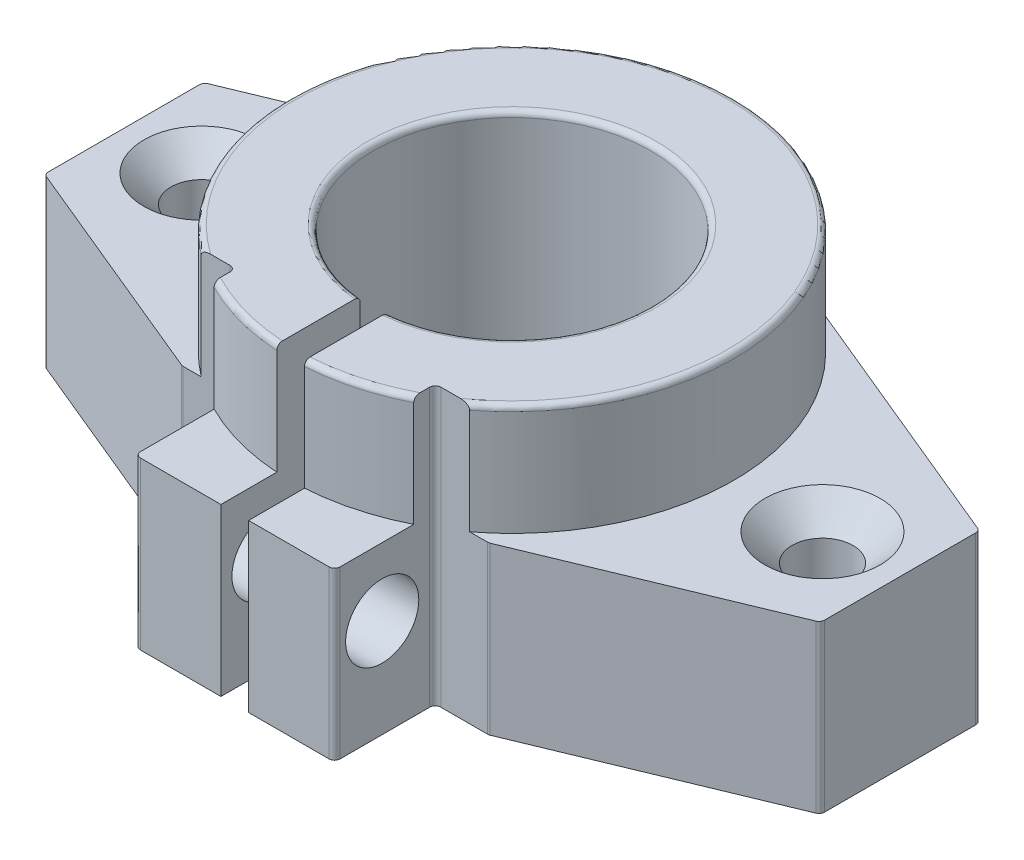
from build123d import *

# Parameters (mm, degrees)
SKETCH1_W                                    = 70
SKETCH1_H                                    = 40
EXTRUDE1_DEPTH                               = 15
SKETCH3_R                                    = 20
EXTRUDE2_DEPTH                               = 10
SKETCH21_W                                   = 18
SKETCH21_H                                   = 45
EXTRUDE7_DEPTH                               = 15
F_25_0_MM_DOWEL_HOLES1_DEPTH                 = 15
F_25_0_MM_DOWEL_HOLES1_2_OUTLINE_R           = 12.5
F_25_0_MM_DOWEL_HOLES1_2_DEPTH               = 25
CSK_FOR_M5_COUNTERSUNK_FLAT_HEAD_SCR_2_COUNT = 2
CSK_FOR_M5_COUNTERSUNK_FLAT_HEAD_SCR_2_PITCH = 56
EXTRUDE8_START                               = -15
EXTRUDE8_DEPTH                               = 15
FILLET10_R                                   = 0.5
EXTRUDE9_DEPTH                               = 46.552167896
SKETCH23_W                                   = 2.5
SKETCH23_H                                   = 25
EXTRUDE10_DEPTH                              = 50.749371906
FILLET11_R                                   = 0.5
M6_CLEARANCE_HOLE1_D                         = 6.6


with BuildPart() as part:
    # Sketch1 → Extrude1 (new body)
    with BuildSketch(Plane(origin=(0, 0, 0), x_dir=(1, 0, 0), z_dir=(0, 1, 0))):
        Rectangle(SKETCH1_W, SKETCH1_H)
    extrude(amount=EXTRUDE1_DEPTH)

    # Sketch3 → Extrude2 (add)
    with BuildSketch(Plane(origin=(0, 15, 0), x_dir=(1, 0, 0), z_dir=(0, 1, 0))):
        with Locations(Location((0, 0, 0), (0, 0, 270))):
            Circle(SKETCH3_R)
    extrude(amount=EXTRUDE2_DEPTH)

    # 25.0 mm Dowel Holes1 2 outline → 25.0 mm Dowel Holes1 2 (cut)
    with BuildSketch(Plane(origin=(0, 0, 0), x_dir=(1, 0, 0), z_dir=(0, 1, 0))):
        Circle(F_25_0_MM_DOWEL_HOLES1_2_OUTLINE_R)
    extrude(amount=F_25_0_MM_DOWEL_HOLES1_2_DEPTH, mode=Mode.SUBTRACT)

    # Sketch11 → CSK for M5 Countersunk Flat Head Screw1 (revolve, cut)
    with BuildSketch(Plane(origin=(-28, 15, 0), x_dir=(0, 0, 1), z_dir=(1, 0, 0))):
        Polygon((0, 0), (0, 15), (5.2, 15), (2.75, 12.55), (2.75, 2.45), (5.2, 0), align=None)
    csk_for_m5_countersunk_flat_head_screw1 = revolve(axis=Axis((-28, 21.35, 0), (0, -1, 0)), mode=Mode.SUBTRACT)

    # CSK for M5 Countersunk Flat Head Scr 2: CSK for M5 Countersunk Flat Head Screw1 ×2
    with Locations(*[(i * CSK_FOR_M5_COUNTERSUNK_FLAT_HEAD_SCR_2_PITCH, 0, 0) for i in range(1, CSK_FOR_M5_COUNTERSUNK_FLAT_HEAD_SCR_2_COUNT)]):
        add(csk_for_m5_countersunk_flat_head_screw1, mode=Mode.SUBTRACT)


with BuildPart() as body_2:
    # Sketch21 → Extrude7 (new body)
    with BuildSketch(Plane.XZ):
        with Locations((0, 2.5)):
            Rectangle(SKETCH21_W, SKETCH21_H)
    extrude(amount=-EXTRUDE7_DEPTH)

    # Ø25.0 mm Dowel Holes1: read off the stored shape, not the designer's step
    # Ø25.0 mm Dowel Holes1 outline → Ø25.0 mm Dowel Holes1 (cut)
    with BuildSketch(Plane(origin=(0, 0, 0), x_dir=(1, 0, 0), z_dir=(0, 1, 0))):
        with BuildLine():
            Line((-9, 20), (-9, -8.674675786))
            ThreePointArc((-9, -8.674675786), (0, -12.5), (9, -8.674675786))
            Line((9, -8.674675786), (9, 20))
            Line((9, 20), (-9, 20))
        make_face()
    extrude(amount=F_25_0_MM_DOWEL_HOLES1_DEPTH, mode=Mode.SUBTRACT)


with BuildPart() as part_1:
    add(part.part)

    # Sculpt4: read off the stored shape, not the designer's step
    # Sculpt4: union body 2
    add(body_2.part)

    # Extrude8: read off the stored shape, not the designer's step
    # Extrude8 outline → Extrude8 (cut)
    with BuildSketch(Plane(origin=(0, 15, 0), x_dir=(1, 0, 0), z_dir=(0, 1, 0)).offset(EXTRUDE8_START)):
        Polygon((35, -20), (35, -7.150369323), (9, -17.919921944), (9, -20), align=None)
        with BuildLine():
            Line((-35, 20), (-35, 7.150369323))
            Line((-35, 7.150369323), (-7.653668647, 18.47759065))
            ThreePointArc((-7.653668647, 18.47759065), (-3.901806443, 19.615705608), (-6e-09, 20))
            Line((-6e-09, 20), (-35, 20))
        make_face()
        Polygon((-9, -20), (-9, -17.919921944), (-35, -7.150369323), (-35, -20), align=None)
        with BuildLine():
            Line((35, 20), (-6e-09, 20))
            ThreePointArc((-6e-09, 20), (3.901806437, 19.615705609), (7.653668647, 18.47759065))
            Line((7.653668647, 18.47759065), (35, 7.150369323))
            Line((35, 7.150369323), (35, 20))
        make_face()
    extrude(amount=EXTRUDE8_DEPTH, mode=Mode.SUBTRACT)

    # Fillet10
    fillet10_edges = [part_1.edges().sort_by_distance(p)[0] for p in [
        (0, 25, -20),
        (-12.5, 25, 0),
        (-35, 7.5, -7.150369323),
        (35, 7.5, -7.150369323),
        (35, 7.5, 7.150369323),
        (-35, 7.5, 7.150369323),
        (-9, 7.5, 25),
        (9, 7.5, 25),
    ]]
    fillet(fillet10_edges, radius=FILLET10_R)

    # Sketch22 → Extrude9 (cut, symmetric)
    with BuildSketch(Plane(origin=(0, 15, 0), x_dir=(1, 0, 0), z_dir=(0, 1, 0))):
        Polygon((-9, -149.154505921), (-9, -17.919921944), (-9, -15.919921944), (-13.828427125, -15.919921944), (-145.063011101, -15.919921944), (-328.697324176, -203.452594264), (-192.634313075, -336.68717824), align=None)
    extrude9 = extrude(amount=EXTRUDE9_DEPTH, both=True, mode=Mode.SUBTRACT)

    # Mirror3: Extrude9 across plane
    add(extrude9.mirror(Plane(origin=(0, 0, 0), x_dir=(0, 0, 1), z_dir=(1, 0, 0))), mode=Mode.SUBTRACT)

    # Sketch23 → Extrude10 (cut, through all)
    with BuildSketch(Plane.XZ):
        with Locations((0, 12.5)):
            Rectangle(SKETCH23_W, SKETCH23_H)
    extrude(amount=-EXTRUDE10_DEPTH, mode=Mode.SUBTRACT)

    # Fillet11
    fillet11_edges = [part_1.edges().sort_by_distance(p)[0] for p in [
        (-9, 12.5, 15.919921944),
        (-13.828427124, 7.5, 15.919921944),
        (13.828427124, 7.5, 15.919921944),
        (9, 12.5, 15.919921944),
    ]]
    fillet(fillet11_edges, radius=FILLET11_R)

    # M6 Clearance Hole1 (through all)
    with Locations(Plane.ZY.offset(9)):
        with Locations((20.704631923, 8.886572753)):
            Hole(M6_CLEARANCE_HOLE1_D / 2)


solid = part_1.part
